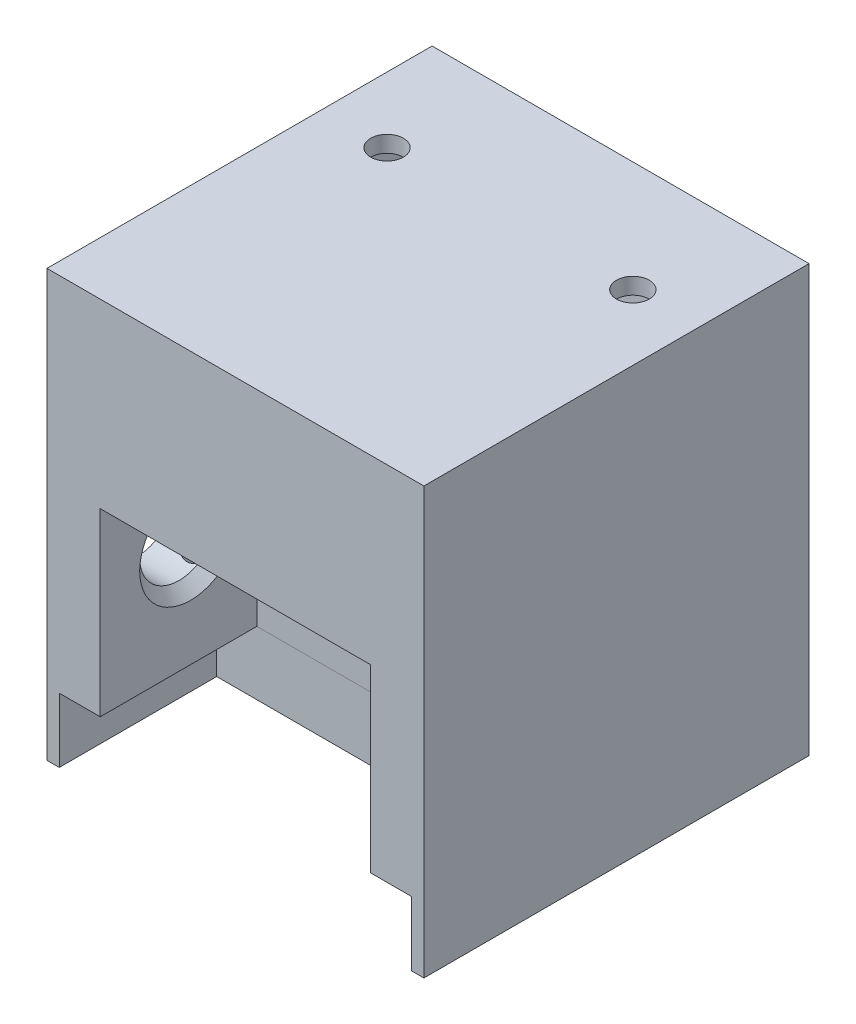
from build123d import *

# Parameters (mm, degrees)
SKETCH1_W           = 58.42
SKETCH1_H           = 34.29
SKETCH1_W_2         = 22.86
SKETCH1_H_2         = 24.13
SKETCH1_H_3         = 25.4
BOSS_EXTRUDE1_DEPTH = 63.5
SKETCH2_W           = 58.42
SKETCH2_H           = 59.69
BOSS_EXTRUDE2_DEPTH = 2.54
SKETCH3_R           = 2.54
CUT_EXTRUDE1_DEPTH  = 84.81278378
SKETCH6_W           = 54.61
SKETCH6_H           = 20.828
CUT_EXTRUDE3_DEPTH  = 9.979406
SKETCH7_R           = 2.2352
CUT_EXTRUDE4_DEPTH  = 12.7
SKETCH9_W           = 41.91
SKETCH9_H           = 20.574
CUT_EXTRUDE5_DEPTH  = 27.94
SKETCH10_R          = 6.096
CUT_EXTRUDE6_DEPTH  = 94.208829249
CUT_EXTRUDE7_DEPTH  = 92.374500249
CHAMFER1_SIZE       = 1.778


with BuildPart() as part:
    # Sketch1 → Boss-Extrude1 (new body)
    # profile 1 of 2: a face of its own
    with BuildSketch(Plane(origin=(0, 0, 0), x_dir=(1, 0, 0), z_dir=(0, 1, 0))):
        Rectangle(SKETCH1_W, SKETCH1_H)
        with Locations((-12.7, 0)):
            Rectangle(SKETCH1_W_2, SKETCH1_H_2, mode=Mode.SUBTRACT)
        with Locations((12.7, 0)):
            Rectangle(SKETCH1_W_2, SKETCH1_H_2, mode=Mode.SUBTRACT)
    # profile 2 of 2: a face of its own
    with BuildSketch(Plane(origin=(0, 0, 0), x_dir=(1, 0, 0), z_dir=(0, 1, 0))):
        with Locations((0, -29.845)):
            Rectangle(SKETCH1_W, SKETCH1_H_3)
    extrude(amount=BOSS_EXTRUDE1_DEPTH)

    # Sketch2 → Boss-Extrude2 (add)
    with BuildSketch(Plane(origin=(0, 63.5, 0), x_dir=(1, 0, 0), z_dir=(0, 1, 0))):
        with Locations((0, -12.7)):
            Rectangle(SKETCH2_W, SKETCH2_H)
    extrude(amount=BOSS_EXTRUDE2_DEPTH)

    # Sketch3 → Cut-Extrude1 (cut, through all)
    with BuildSketch(Plane(origin=(0, 66.04, 0), x_dir=(1, 0, 0), z_dir=(0, 1, 0))):
        with Locations(Location((-19.05, 0, 0), (0, 0, 270))):
            Circle(SKETCH3_R)
        with Locations(Location((19.05, 0, 0), (0, 0, 270))):
            Circle(SKETCH3_R)
    extrude(amount=-CUT_EXTRUDE1_DEPTH, mode=Mode.SUBTRACT)

    # Sketch6 → Cut-Extrude3 (cut)
    with BuildSketch(Plane.XZ):
        with Locations((0, 28.557227446)):
            Rectangle(SKETCH6_W, SKETCH6_H)
    extrude(amount=-CUT_EXTRUDE3_DEPTH, mode=Mode.SUBTRACT)

    # Sketch7 → Cut-Extrude4 (cut)
    with BuildSketch(Plane.XZ.offset(-9.979406)):
        with Locations(Location((24.09, 36.930859788, 0), (0, 0, 270))):
            Circle(SKETCH7_R)
        with Locations(Location((24.09, 23.757367658, 0), (0, 0, 270))):
            Circle(SKETCH7_R)
        with Locations(Location((-24.09, 23.757367658, 0), (0, 0, 270))):
            Circle(SKETCH7_R)
        with Locations(Location((-24.09, 36.930859788, 0), (0, 0, 270))):
            Circle(SKETCH7_R)
    extrude(amount=-CUT_EXTRUDE4_DEPTH, mode=Mode.SUBTRACT)

    # Sketch9 → Cut-Extrude5 (cut)
    with BuildSketch(Plane.XZ.offset(-9.979406)):
        with Locations((0, 28.557227446)):
            Rectangle(SKETCH9_W, SKETCH9_H)
    extrude(amount=-CUT_EXTRUDE5_DEPTH, mode=Mode.SUBTRACT)

    # Sketch10 → Cut-Extrude6 (cut, through all)
    with BuildSketch(Plane(origin=(-20.955, 0, 0), x_dir=(0, 0, -1), z_dir=(1, 0, 0))):
        with Locations((-28.557227446, 26.477976)):
            Circle(SKETCH10_R)
    extrude(amount=-CUT_EXTRUDE6_DEPTH, mode=Mode.SUBTRACT)

    # Sketch11 → Cut-Extrude7 (cut, through all)
    with BuildSketch(Plane(origin=(0, 0, 38.844227446), x_dir=(-1, 0, 0), z_dir=(0, 0, -1))):
        Polygon((-27.305, 0), (27.305, 0), (27.305, 9.979406), (25.002698669, 9.979406), (23.177301331, 9.979406), (20.955, 9.979406), (20.955, 37.919406), (-20.955, 37.919406), (-20.955, 9.979406), (-23.177301331, 9.979406), (-25.002698669, 9.979406), (-27.305, 9.979406), align=None)
    extrude(amount=-CUT_EXTRUDE7_DEPTH, mode=Mode.SUBTRACT)

    # Chamfer1
    # the kernel refuses this chamfer: 1.778 mm, written as the material it takes off along each edge
    with BuildSketch(Plane(origin=(-20.955, 26.477976, 28.557227446), x_dir=(0, 0, -1), z_dir=(0, -1, 0))) as chamfer1_piece_1:
        Polygon((6.096, -CHAMFER1_SIZE), (6.096 + CHAMFER1_SIZE, 0), (6.096, 0), align=None)
    revolve(axis=Axis((-20.955, 26.477976, 28.557227446), (1, 0, 0)), mode=Mode.SUBTRACT)


solid = part.part
